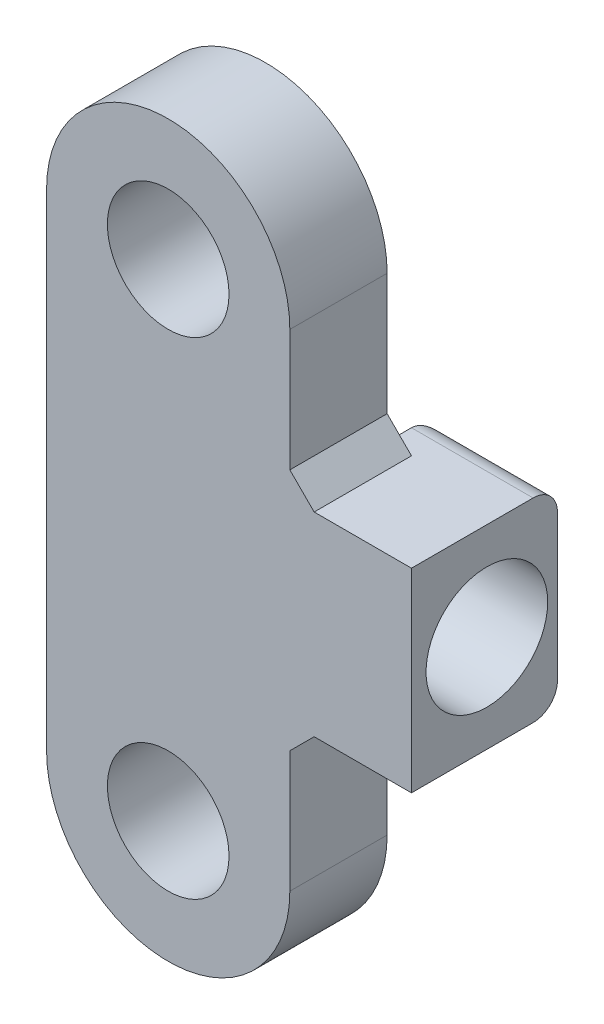
from build123d import *

# Parameters (mm, degrees)
SKETCH_1_R      = 2.5
EXTRUDE_1_DEPTH = 4
SKETCH_2_W      = 6
SKETCH_2_H      = 8
SKETCH_2_R      = 2.5
EXTRUDE_2_DEPTH = 5
CHAMFER_1_SIZE  = 1
FILLET_1_R      = 1


with BuildPart() as part:
    # 草图1 → 凸台-拉伸1 (new body)
    with BuildSketch(Plane.XY):
        with BuildLine():
            Line((5, 10), (5, -10))
            ThreePointArc((5, -10), (0, -15), (-5, -10))
            Line((-5, -10), (-5, 10))
            ThreePointArc((-5, 10), (0, 15), (5, 10))
        make_face()
        with Locations((0, 10)):
            Circle(SKETCH_1_R, mode=Mode.SUBTRACT)
        with Locations((0, -10)):
            Circle(SKETCH_1_R, mode=Mode.SUBTRACT)
    extrude(amount=EXTRUDE_1_DEPTH)

    # 草图2 → 凸台-拉伸2 (add)
    with BuildSketch(Plane(origin=(5, 0, 0), x_dir=(0, 0, -1), z_dir=(1, 0, 0))):
        with Locations((-1, 0)):
            Rectangle(SKETCH_2_W, SKETCH_2_H)
        with Locations(Location((-0.9, 0, 0), (0, 0, 68.899803976))):
            Circle(SKETCH_2_R, mode=Mode.SUBTRACT)
    extrude(amount=EXTRUDE_2_DEPTH)

    # 倒角1
    chamfer_1_edges = [part.edges().sort_by_distance(p)[0] for p in [
        (5, -4, 2),
        (5, 4, 2),
    ]]
    chamfer(chamfer_1_edges, length=CHAMFER_1_SIZE)

    # 圆角1
    # the kernel refuses this fillet: 1 mm, written as the material it takes off along each edge
    with BuildSketch(Plane(origin=(5, 6.5, -2), x_dir=(0, 0, 1), z_dir=(0, -1, 0))) as fillet_1_piece_1:
        with BuildLine():
            CenterArc((FILLET_1_R, -FILLET_1_R), FILLET_1_R, 90, 90)
            Line((0, -FILLET_1_R), (0, 0))
            Line((0, 0), (FILLET_1_R, 0))
        make_face()
    extrude(amount=13, mode=Mode.SUBTRACT)
    with BuildSketch(Plane(origin=(2.5, -4, -2), x_dir=(0, 0, 1), z_dir=(1, 0, 0))) as fillet_1_piece_2:
        with BuildLine():
            CenterArc((FILLET_1_R, -FILLET_1_R), FILLET_1_R, 90, 90)
            Line((0, -FILLET_1_R), (0, 0))
            Line((0, 0), (FILLET_1_R, 0))
        make_face()
    extrude(amount=10, mode=Mode.SUBTRACT)
    with BuildSketch(Plane(origin=(2.5, 4, -2), x_dir=(0, 0, 1), z_dir=(1, 0, 0))) as fillet_1_piece_3:
        with BuildLine():
            CenterArc((FILLET_1_R, FILLET_1_R), FILLET_1_R, 180, 90)
            Line((0, FILLET_1_R), (0, 0))
            Line((0, 0), (FILLET_1_R, 0))
        make_face()
    extrude(amount=10, mode=Mode.SUBTRACT)


solid = part.part
